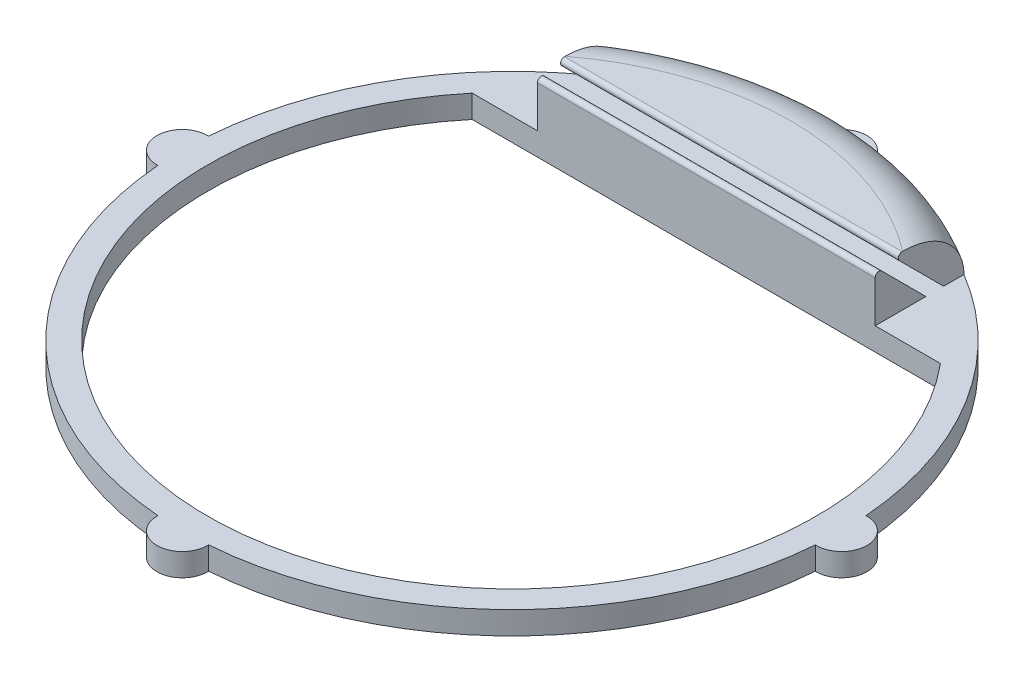
from build123d import *

# Parameters (mm, degrees)
BOSS_EXTRUDE1_DEPTH = 1.8
BOSS_EXTRUDE3_DEPTH = 4
CUT_EXTRUDE1_DEPTH  = 51.248019596
FILLET1_R           = 4
FILLET2_R           = 0.3


with BuildPart() as part:
    # Sketch1 → Boss-Extrude1 (new body)
    with BuildSketch(Plane(origin=(0, 0, 0), x_dir=(1, 0, 0), z_dir=(0, 1, 0))):
        with BuildLine():
            ThreePointArc((-1.998520163, 25.923076923), (-18.384776311, 18.384776311), (-25.923076923, 1.998520163))
            ThreePointArc((-25.923076923, 1.998520163), (-28, 0), (-25.923076923, -1.998520163))
            ThreePointArc((-25.923076923, -1.998520163), (-18.384776311, -18.384776311), (-1.998520163, -25.923076923))
            ThreePointArc((-1.998520163, -25.923076923), (0, -28), (1.998520163, -25.923076923))
            ThreePointArc((1.998520163, -25.923076923), (18.384776311, -18.384776311), (25.923076923, -1.998520163))
            ThreePointArc((25.923076923, -1.998520163), (28, 0), (25.923076923, 1.998520163))
            ThreePointArc((25.923076923, 1.998520163), (18.384776311, 18.384776311), (1.998520163, 25.923076923))
            ThreePointArc((1.998520163, 25.923076923), (0, 28), (-1.998520163, 25.923076923))
        make_face()
        with BuildLine():
            Line((-18.466185313, 15.329709717), (18.466185313, 15.329709717))
            ThreePointArc((18.466185313, 15.329709717), (0, -24), (-18.466185313, 15.329709717))
        make_face(mode=Mode.SUBTRACT)
    extrude(amount=BOSS_EXTRUDE1_DEPTH)

    # Sketch2 → Boss-Extrude3 (add)
    with BuildSketch(Plane(origin=(0, 1.8, 0), x_dir=(1, 0, 0), z_dir=(0, 1, 0))):
        with BuildLine():
            Line((-13.318560882, 15.329709717), (13.318560882, 15.329709717))
            Line((13.318560882, 15.329709717), (13.318560882, 22.329709717))
            ThreePointArc((13.318560882, 22.329709717), (0, 26), (-13.318560882, 22.329709717))
            Line((-13.318560882, 22.329709717), (-13.318560882, 15.329709717))
        make_face()
    extrude(amount=BOSS_EXTRUDE3_DEPTH)

    # Sketch3 → Cut-Extrude1 (cut, through all)
    with BuildSketch(Plane.ZY.offset(13.318560882)):
        Polygon((-15.329709717, 5.8), (-19.329709717, 1.8), (-20.729709717, 1.8), (-16.729709717, 5.8), align=None)
    extrude(amount=-CUT_EXTRUDE1_DEPTH, mode=Mode.SUBTRACT)

    # Fillet1
    fillet1_edges = [part.edges().sort_by_distance(p)[0] for p in [
        (0, 5.8, -26),
    ]]
    fillet(fillet1_edges, radius=FILLET1_R - 0.0001)  # a hair under: the kernel refuses the full size

    # Fillet2
    fillet2_edges = [part.edges().sort_by_distance(p)[0] for p in [
        (0, 5.8, -15.329709717),
        (0, 5.8, -16.729709717),
    ]]
    fillet(fillet2_edges, radius=FILLET2_R)


solid = part.part
